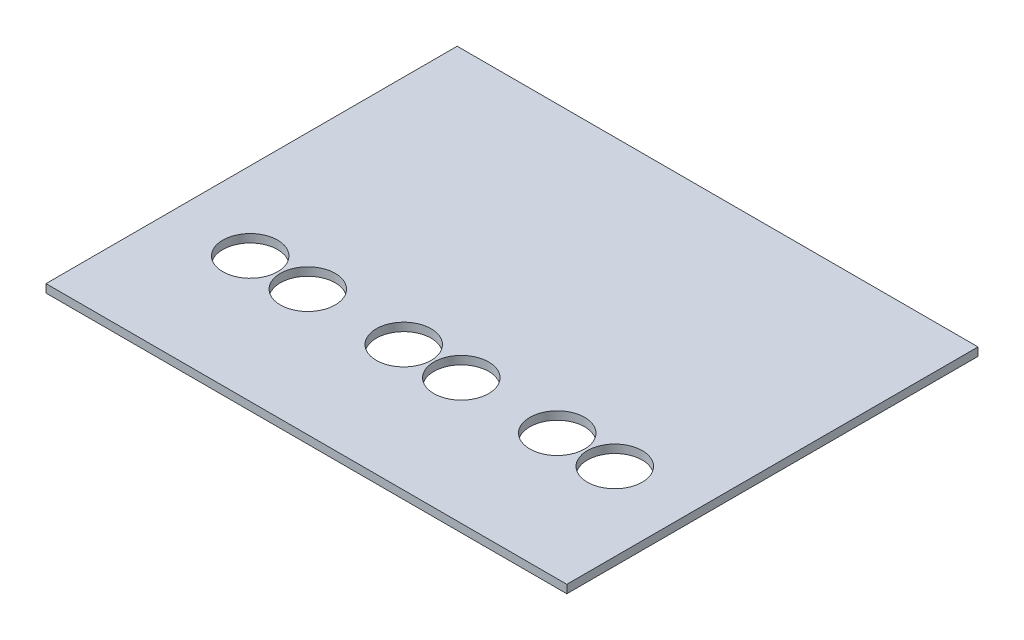
from build123d import *

# Parameters (mm, degrees)
SKETCH1_W          = 190
SKETCH1_H          = 150
SKETCH1_R          = 10
BASE_FLANGE1_DEPTH = 3


# Sheet-metal steps are written as plain solids
with BuildPart() as part:
    # Sketch1 → Base-Flange1 (new body)
    with BuildSketch(Plane(origin=(0, 0, 0), x_dir=(1, 0, 0), z_dir=(0, 1, 0))):
        with Locations((95, 75)):
            Rectangle(SKETCH1_W, SKETCH1_H)
        with Locations(Location((28.5, 46, 0), (0, 0, 270))):
            Circle(SKETCH1_R, mode=Mode.SUBTRACT)
        with Locations(Location((49.5, 46, 0), (0, 0, 270))):
            Circle(SKETCH1_R, mode=Mode.SUBTRACT)
        with Locations(Location((84.5, 46, 0), (0, 0, 270))):
            Circle(SKETCH1_R, mode=Mode.SUBTRACT)
        with Locations(Location((105.5, 46, 0), (0, 0, 270))):
            Circle(SKETCH1_R, mode=Mode.SUBTRACT)
        with Locations(Location((140.5, 46, 0), (0, 0, 270))):
            Circle(SKETCH1_R, mode=Mode.SUBTRACT)
        with Locations(Location((161.5, 46, 0), (0, 0, 270))):
            Circle(SKETCH1_R, mode=Mode.SUBTRACT)
    extrude(amount=-BASE_FLANGE1_DEPTH)


solid = part.part
